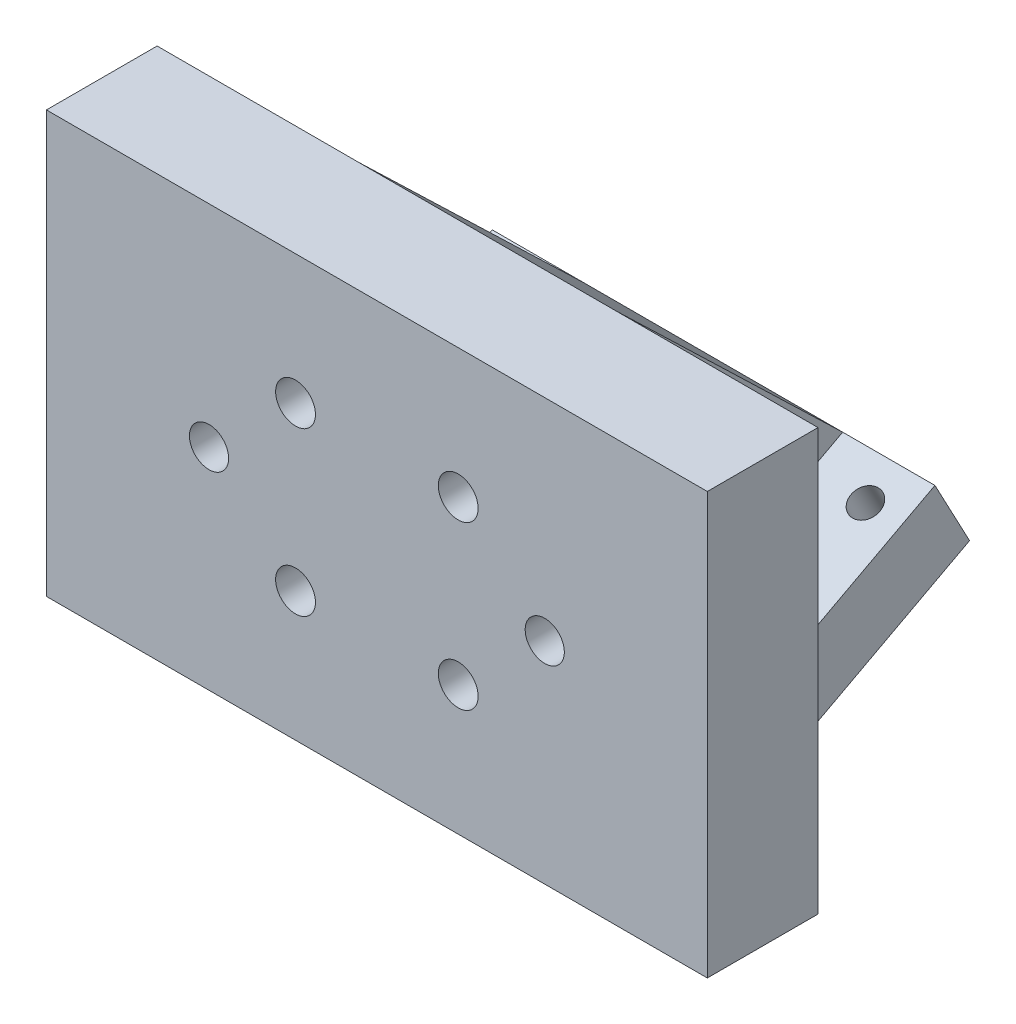
from build123d import *

# Parameters (mm, degrees)
SKETCH1_W                      = 113.7412
SKETCH1_H                      = 72.517
BOSS_EXTRUDE1_DEPTH            = 9.525
BOSS_EXTRUDE5_START            = -38.1
BOSS_EXTRUDE5_DEPTH            = 76.2
CUT_EXTRUDE3_REACH             = 88.637
SKETCH1_6_R                    = 3.37
CUT_EXTRUDE3_DIRECTION_2_DEPTH = 87.637123003
BOSS_EXTRUDE6_DEPTH            = 22.225
SKETCH7_R                      = 2.4892
CUT_EXTRUDE4_DEPTH             = 92.543856508
SKETCH8_R                      = 3.429
CUT_EXTRUDE5_DEPTH             = 5.08
CUT_EXTRUDE7_DEPTH             = 6.35
FILLET2_R                      = 0.79375


# Read off the part's stored shape, not the designer's step: Boss-Extrude5
with BuildPart() as part:
    # Sketch1 → Boss-Extrude1 (new, symmetric)
    with BuildSketch(Plane.XY):
        Rectangle(SKETCH1_W, SKETCH1_H)
    extrude(amount=BOSS_EXTRUDE1_DEPTH, both=True)

    # Boss-Extrude5 outline → Boss-Extrude5 (add)
    with BuildSketch(Plane(origin=(0, 0, 0), x_dir=(0, 0, -1), z_dir=(1, 0, 0)).offset(BOSS_EXTRUDE5_START)):
        Polygon((54.378737717, -12.40934461), (48.41644887, -1.195910181), (9.525, -21.874860356), (9.525, -36.2585), align=None)
    extrude(amount=BOSS_EXTRUDE5_DEPTH)

    # Sketch1<6> → Cut-Extrude3 (cut, up to next)
    with BuildSketch(Plane.XY, mode=Mode.PRIVATE) as cut_extrude3_sk1:
        with Locations(Location((-28.8925, 0, 0), (0, 0, 180))):
            Circle(SKETCH1_6_R)
    cut_extrude3_tool1 = extrude(cut_extrude3_sk1.sketch, amount=-CUT_EXTRUDE3_REACH, mode=Mode.PRIVATE) & part.part
    # Sketch1<6> → Cut-Extrude3 (cut, up to next)
    with BuildSketch(Plane.XY, mode=Mode.PRIVATE) as cut_extrude3_sk2:
        with Locations(Location((28.8925, 0, 0), (0, 0, 180))):
            Circle(SKETCH1_6_R)
    cut_extrude3_tool2 = extrude(cut_extrude3_sk2.sketch, amount=-CUT_EXTRUDE3_REACH, mode=Mode.PRIVATE) & part.part
    add(cut_extrude3_tool1.solids().sort_by_distance((-28.8925, 0, 0))[0], mode=Mode.SUBTRACT)
    add(cut_extrude3_tool2.solids().sort_by_distance((28.8925, 0, 0))[0], mode=Mode.SUBTRACT)

    # Sketch1<6> → Cut-Extrude3 direction 2 (cut)
    with BuildSketch(Plane.XY):
        with Locations(Location((-28.8925, 0, 0), (0, 0, 180))):
            Circle(SKETCH1_6_R)
        with Locations(Location((28.8925, 0, 0), (0, 0, 180))):
            Circle(SKETCH1_6_R)
    extrude(amount=CUT_EXTRUDE3_DIRECTION_2_DEPTH, mode=Mode.SUBTRACT)

    # Sketch6 → Boss-Extrude6 (add, symmetric)
    with BuildSketch(Plane(origin=(0, 0, 0), x_dir=(0, 0, -1), z_dir=(1, 0, 0))):
        Polygon((9.525, 36.2585), (9.525, -21.874860356), (48.41644887, -1.195910181), align=None)
    extrude(amount=BOSS_EXTRUDE6_DEPTH, both=True)

    # Sketch7 → Cut-Extrude4 (cut, through all)
    with BuildSketch(Plane(origin=(0, -21.001854955, -11.166884362), x_dir=(1, 0, 0), z_dir=(0, 0.882947592858928, 0.46947156278588875))):
        with Locations(Location((31.75, 35.837741163, 0), (0, 0, 270))):
            Circle(SKETCH7_R)
        with Locations(Location((31.75, 16.787741163, 0), (0, 0, 270))):
            Circle(SKETCH7_R)
        with Locations(Location((-31.75, 35.837741163, 0), (0, 0, 270))):
            Circle(SKETCH7_R)
        with Locations(Location((-31.75, 16.787741163, 0), (0, 0, 270))):
            Circle(SKETCH7_R)
    extrude(amount=-CUT_EXTRUDE4_DEPTH, mode=Mode.SUBTRACT)

    # Sketch8 → Cut-Extrude5 (cut)
    with BuildSketch(Plane.XY.offset(9.525)):
        with Locations((-14, 14)):
            Circle(SKETCH8_R)
        with Locations((14, 14)):
            Circle(SKETCH8_R)
        with Locations((-14, -14)):
            Circle(SKETCH8_R)
        with Locations((14, -14)):
            Circle(SKETCH8_R)
    extrude(amount=-CUT_EXTRUDE5_DEPTH, mode=Mode.SUBTRACT)

    # Sketch11 → Cut-Extrude7 (cut)
    with BuildSketch(Plane(origin=(22.225, 0, 0), x_dir=(0, 0, -1), z_dir=(1, 0, 0))):
        Polygon((9.525, 3.37), (9.525, -3.37), (9.525, -8.1325), (15.875, -8.1325), (15.875, 8.1325), (9.525, 8.1325), align=None)
    cut_extrude7 = extrude(amount=-CUT_EXTRUDE7_DEPTH, mode=Mode.SUBTRACT)

    # Mirror1: Cut-Extrude7 across plane
    add(cut_extrude7.mirror(Plane(origin=(0, 0, 0), x_dir=(0, 0, 1), z_dir=(1, 0, 0))), mode=Mode.SUBTRACT)

    # Fillet2
    fillet2_edges = [part.edges().sort_by_distance(p)[0] for p in [
        (19.05, 8.1325, -15.875),
        (19.05, -8.1325, -15.875),
        (-19.05, -8.1325, -15.875),
        (-19.05, 8.1325, -15.875),
    ]]
    fillet(fillet2_edges, radius=FILLET2_R)


solid = part.part
